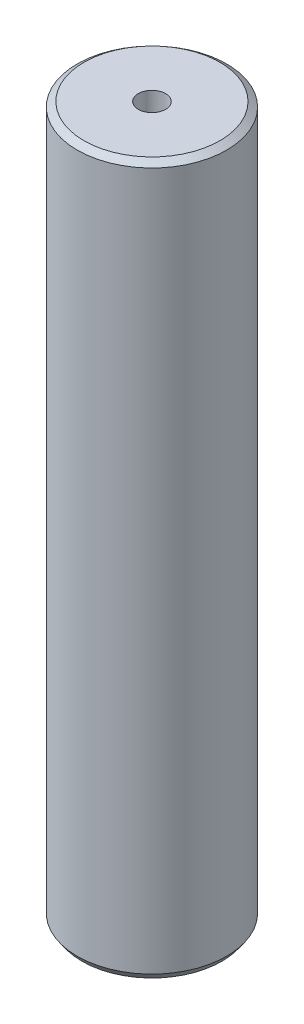
from build123d import *
from OCP.BRepFilletAPI import BRepFilletAPI_MakeChamfer

# Parameters (mm, degrees)
SKETCH1_R           = 5
BOSS_EXTRUDE1_DEPTH = 47.485932003
SKETCH2_R           = 0.914512624
CUT_EXTRUDE1_DEPTH  = 49.009517162
CHAMFER1_SIZE       = 0.320593786
CHAMFER1_SIZE2      = 0.452816816


with BuildPart() as part:
    # Sketch1 → Boss-Extrude1 (new body)
    with BuildSketch(Plane(origin=(0, 0, 0), x_dir=(1, 0, 0), z_dir=(0, 1, 0))):
        Circle(SKETCH1_R)
    extrude(amount=BOSS_EXTRUDE1_DEPTH)

    # Sketch2 → Cut-Extrude1 (cut, through all)
    with BuildSketch(Plane(origin=(0, 0, 0), x_dir=(1, 0, 0), z_dir=(0, 1, 0))):
        Circle(SKETCH2_R)
    extrude(amount=CUT_EXTRUDE1_DEPTH, mode=Mode.SUBTRACT)

    # Chamfer1: one chamfer whose edges measure the first distance from different faces: ONE call of the kernel's chamfer builder (chamfer() names one face for all edges)
    chamfer1_edges_1 = [part.edges().sort_by_distance(p)[0] for p in [
        (-5, 47.485932003, 0),
    ]]
    chamfer1_side_1 = [part.faces().sort_by_distance(p)[0] for p in [
        (-5, 23.742966001, 0),
    ]]
    chamfer1_edges_2 = [part.edges().sort_by_distance(p)[0] for p in [
        (-5, 0, 0),
    ]]
    chamfer1_side_2 = [part.faces().sort_by_distance(p)[0] for p in [
        (-4.858578644, 0, 0),
    ]]
    chamfer1 = BRepFilletAPI_MakeChamfer(part.part.solid().wrapped)
    for e in chamfer1_edges_1:
        chamfer1.Add(CHAMFER1_SIZE, CHAMFER1_SIZE2, e.wrapped, chamfer1_side_1[0].wrapped)  # the first distance lies on this face
    for e in chamfer1_edges_2:
        chamfer1.Add(CHAMFER1_SIZE, CHAMFER1_SIZE2, e.wrapped, chamfer1_side_2[0].wrapped)  # the first distance lies on this face
    add(Compound.cast(chamfer1.Shape()), mode=Mode.REPLACE)


solid = part.part
